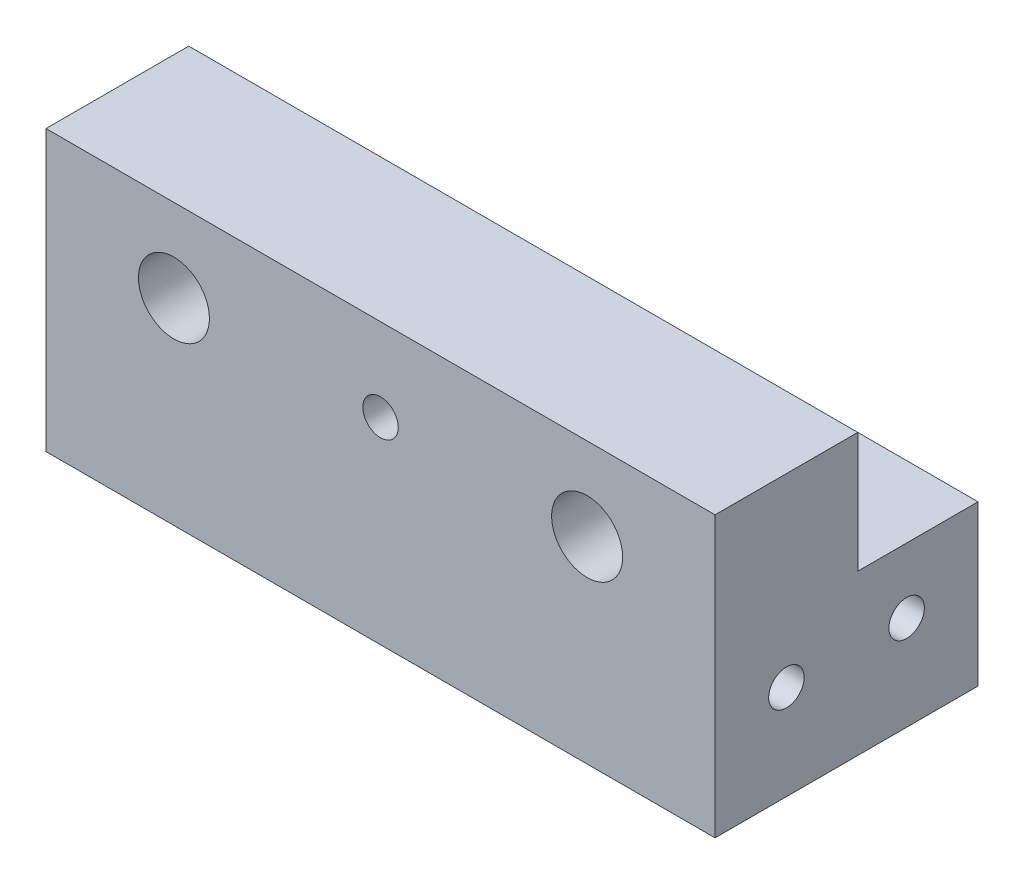
from build123d import *

# Parameters (mm, degrees)
SKETCH1_W           = 56.55
SKETCH1_H           = 22.225
BOSS_EXTRUDE1_DEPTH = 22.225
SKETCH2_R           = 3
SKETCH2_R_2         = 1.5
CUT_EXTRUDE1_DEPTH  = 10
SKETCH3_R           = 1.5
CUT_EXTRUDE2_DEPTH  = 62.768444867
SKETCH4_W           = 10.16
SKETCH4_H           = 10.16
CUT_EXTRUDE3_DEPTH  = 62.768444867
SKETCH5_W           = 56.55
SKETCH5_H           = 22.225
BOSS_EXTRUDE2_DEPTH = 1.42494


with BuildPart() as part:
    # Sketch1 → Boss-Extrude1 (new body)
    with BuildSketch(Plane.XY):
        Rectangle(SKETCH1_W, SKETCH1_H)
    extrude(amount=BOSS_EXTRUDE1_DEPTH)

    # Sketch2 → Cut-Extrude1 (cut)
    with BuildSketch(Plane.XY.offset(22.225)):
        with Locations((17.4625, 4.1125)):
            Circle(SKETCH2_R)
        with Locations((-17.4625, 4.1125)):
            Circle(SKETCH2_R)
        with Locations((0, 4.1125)):
            Circle(SKETCH2_R_2)
    extrude(amount=-CUT_EXTRUDE1_DEPTH, mode=Mode.SUBTRACT)

    # Sketch3 → Cut-Extrude2 (cut, through all)
    with BuildSketch(Plane.ZY.offset(28.275)):
        with Locations((16.1925, -4.5375001)):
            Circle(SKETCH3_R)
        with Locations((6.0325, -4.5375001)):
            Circle(SKETCH3_R)
    extrude(amount=-CUT_EXTRUDE2_DEPTH, mode=Mode.SUBTRACT)

    # Sketch4 → Cut-Extrude3 (cut, through all)
    with BuildSketch(Plane.ZY.offset(28.275)):
        with Locations((5.08, 6.0325)):
            Rectangle(SKETCH4_W, SKETCH4_H)
    extrude(amount=-CUT_EXTRUDE3_DEPTH, mode=Mode.SUBTRACT)

    # Sketch5 → Boss-Extrude2 (add)
    with BuildSketch(Plane.XZ.offset(11.1125)):
        with Locations((0, 11.1125)):
            Rectangle(SKETCH5_W, SKETCH5_H)
    extrude(amount=BOSS_EXTRUDE2_DEPTH)


solid = part.part
